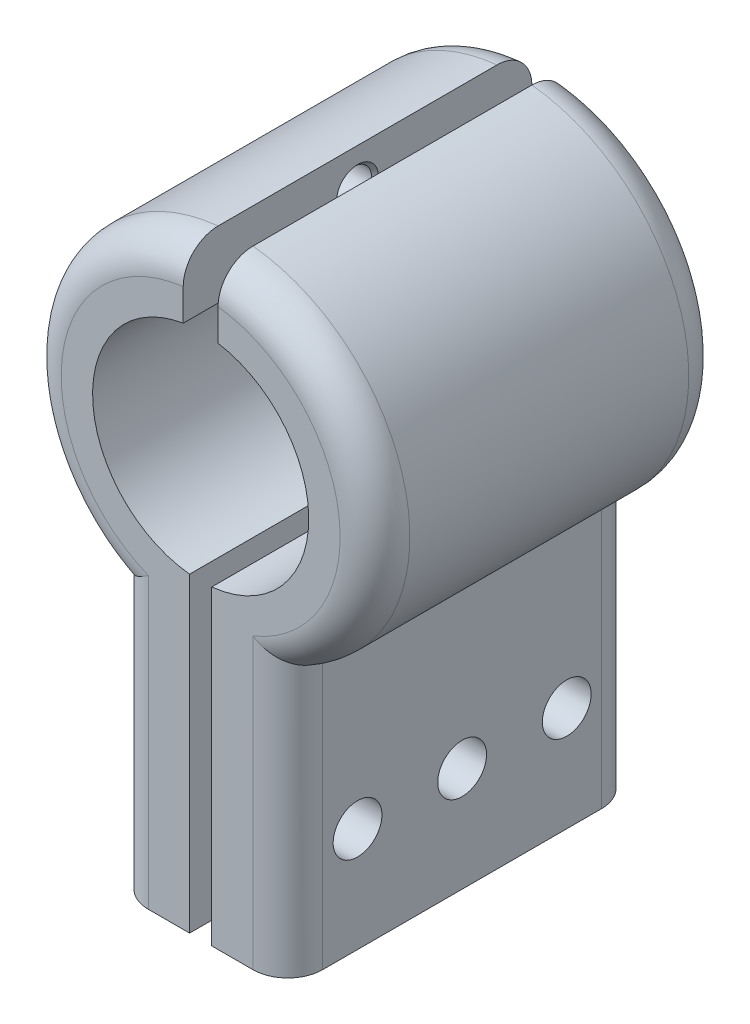
from build123d import *

# Parameters (mm, degrees)
BOSS_EXTRUDE1_DEPTH     = 25
BOSS_EXTRUDE1_2_DEPTH   = 25
FILLET1_R               = 5
FILLET2_R               = 5
CUT_EXTRUDE1_DEPTH      = 76.041655262
CUT_EXTRUDE1_DEPTH_BACK = 76.041655262
SKETCH3_R               = 3.5
SKETCH4_R               = 2.5
CUT_EXTRUDE2_DEPTH      = 8
CHAMFER1_SIZE           = 0.5
CHAMFER2_SIZE           = 0.5


with BuildPart() as part:
    # Sketch1 → Boss-Extrude1 (new, symmetric)
    with BuildSketch(Plane.XY):
        with BuildLine():
            Line((-12.5, -21.650635095), (-12.5, -60))
            Line((-12.5, -60), (-1.59, -60))
            Line((-1.59, -60), (-1.59, -15.418232713))
            ThreePointArc((-1.59, -15.418232713), (-15.493201871, -0.459016116), (-2.5, 15.297058541))
            Line((-2.5, 15.297058541), (-2.5, 24.874685928))
            ThreePointArc((-2.5, 24.874685928), (-24.441795639, 5.253439439), (-12.5, -21.650635095))
        make_face()
    extrude(amount=BOSS_EXTRUDE1_DEPTH, both=True)

    # Fillet1
    fillet1_edges = [part.edges().sort_by_distance(p)[0] for p in [
        (-24.441795639, 5.253439439, 25),
        (-24.441795639, 5.253439439, -25),
        (-12.5, -40.825317547, 25),
        (-12.5, -40.825317547, -25),
    ]]
    fillet(fillet1_edges, radius=FILLET1_R)


with BuildPart() as body_2:
    # Sketch1 → Boss-Extrude1 2 (new, symmetric)
    with BuildSketch(Plane.XY):
        with BuildLine():
            Line((12.5, -21.650635095), (12.5, -60))
            Line((12.5, -60), (1.59, -60))
            Line((1.59, -60), (1.59, -15.418232713))
            ThreePointArc((1.59, -15.418232713), (15.493201871, -0.459016116), (2.5, 15.297058541))
            Line((2.5, 15.297058541), (2.5, 24.874685928))
            ThreePointArc((2.5, 24.874685928), (24.441795639, 5.253439439), (12.5, -21.650635095))
        make_face()
    extrude(amount=BOSS_EXTRUDE1_2_DEPTH, both=True)

    # Fillet2
    fillet2_edges = [body_2.edges().sort_by_distance(p)[0] for p in [
        (24.441795639, 5.253439439, -25),
        (12.5, -40.825317547, -25),
        (12.5, -40.825317547, 25),
        (24.441795639, 5.253439439, 25),
    ]]
    fillet(fillet2_edges, radius=FILLET2_R)


with BuildPart() as cut_extrude1_tool:
    # Sketch3 → Cut-Extrude1 (new, two sides: drawn at the far end of the back side and taken through both)
    with BuildSketch(Plane.ZY.offset(12.5).offset(-CUT_EXTRUDE1_DEPTH_BACK)):
        with Locations((0, -45)):
            Circle(SKETCH3_R)
        with Locations((-15, -45)):
            Circle(SKETCH3_R)
        with Locations((15, -45)):
            Circle(SKETCH3_R)
    extrude(amount=CUT_EXTRUDE1_DEPTH + CUT_EXTRUDE1_DEPTH_BACK)


with BuildPart() as part_1:
    add(part.part)

    # Cut-Extrude1: cut by cut_extrude1_tool
    add(cut_extrude1_tool.part, mode=Mode.SUBTRACT)


with BuildPart() as body_2_1:
    add(body_2.part)

    # Cut-Extrude1: cut by cut_extrude1_tool
    add(cut_extrude1_tool.part, mode=Mode.SUBTRACT)


with BuildPart() as cut_extrude2_tool:
    # Sketch4 → Cut-Extrude2 (new, symmetric)
    with BuildSketch(Plane(origin=(0, 0, 0), x_dir=(0, 0, -1), z_dir=(1, 0, 0))):
        with Locations((0, 19.5)):
            Circle(SKETCH4_R)
    extrude(amount=CUT_EXTRUDE2_DEPTH, both=True)


with BuildPart() as part_2:
    add(part_1.part)

    # Cut-Extrude2: cut by cut_extrude2_tool
    add(cut_extrude2_tool.part, mode=Mode.SUBTRACT)

    # Chamfer1
    chamfer1_edges = [part_2.edges().sort_by_distance(p)[0] for p in [
        (-2.5, 19.5, 2.5),
        (-8, 19.5, 2.5),
    ]]
    chamfer(chamfer1_edges, length=CHAMFER1_SIZE)


with BuildPart() as body_2_2:
    add(body_2_1.part)

    # Cut-Extrude2: cut by cut_extrude2_tool
    add(cut_extrude2_tool.part, mode=Mode.SUBTRACT)

    # Chamfer2
    chamfer2_edges = [body_2_2.edges().sort_by_distance(p)[0] for p in [
        (8, 19.5, 2.5),
        (2.5, 19.5, 2.5),
    ]]
    chamfer(chamfer2_edges, length=CHAMFER2_SIZE)


solid = Compound([part_2.part, body_2_2.part])
